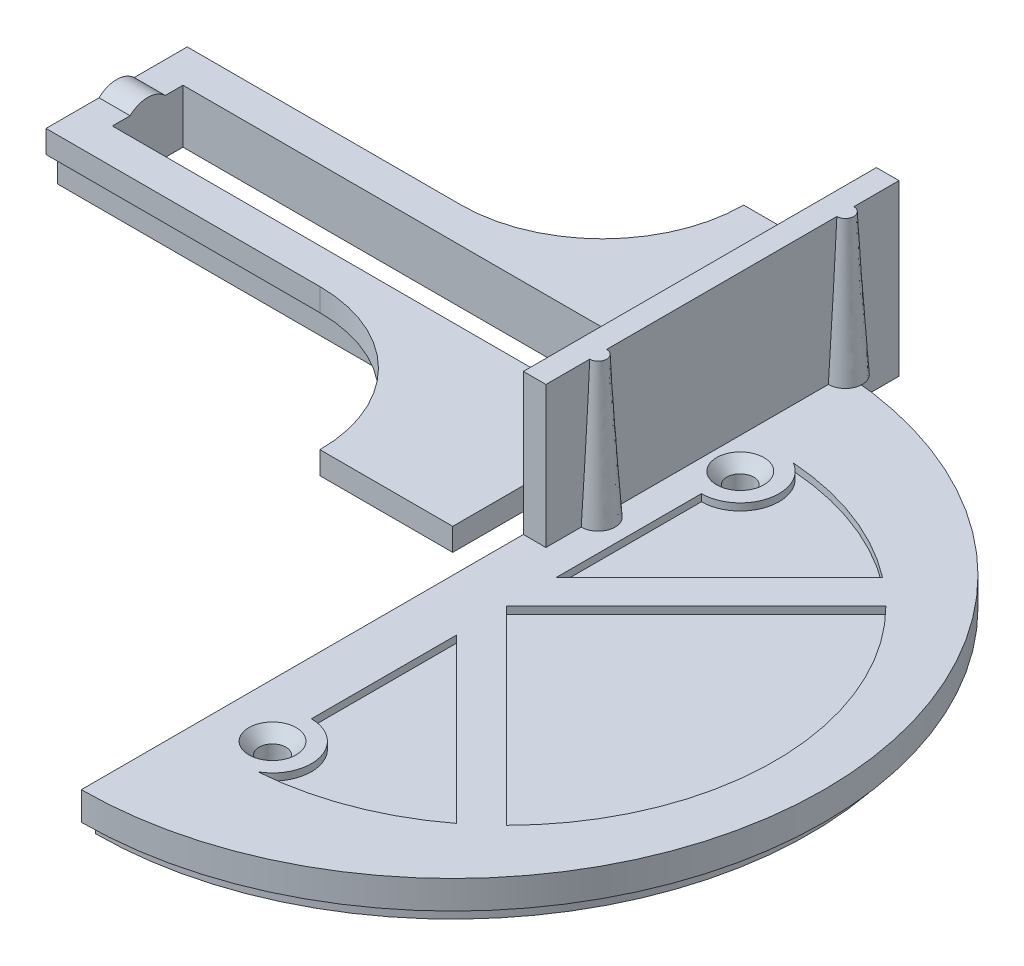
from build123d import *

# Parameters (mm, degrees)
BOSS_EXTRUDE1_DEPTH                           = 98.552
CUT_EXTRUDE2_DEPTH                            = 100.834602258
CUT_EXTRUDE2_DEPTH_BACK                       = 100.834602258
SKETCH2_W                                     = 92.964
SKETCH2_H                                     = 3.187725502
BOSS_EXTRUDE2_START                           = -4.064
BOSS_EXTRUDE2_DEPTH                           = 4.064
SKETCH10_W                                    = 4.064
SKETCH10_H                                    = 8.636
BOSS_EXTRUDE3_DEPTH                           = 63.5
REVOLVE1_ANGLE                                = 180
CUT_EXTRUDE3_DEPTH                            = 1.27
CSK_FOR_1_FLAT_HEAD_SOCKET_CAP_SCREW1_A_COUNT = 2
CSK_FOR_1_FLAT_HEAD_SOCKET_CAP_SCREW1_A_PITCH = 84.1248


with BuildPart() as part:
    # Sketch1 → Boss-Extrude1 (new body)
    with BuildSketch(Plane(origin=(0, 0, 0), x_dir=(0, 0, -1), z_dir=(1, 0, 0))):
        with BuildLine():
            Line((-10.668, -4.826), (10.668, -4.826))
            Line((10.668, -4.826), (10.668, 0.762))
            Line((10.668, 0.762), (12.7, 0.762))
            Line((12.7, 0.762), (12.7, 4.826))
            Line((12.7, 4.826), (3.162274498, 4.826))
            ThreePointArc((3.162274498, 4.826), (0, 6.096), (-3.162274498, 4.826))
            Line((-3.162274498, 4.826), (-12.7, 4.826))
            Line((-12.7, 4.826), (-12.7, 0.762))
            Line((-12.7, 0.762), (-10.668, 0.762))
            Line((-10.668, 0.762), (-10.668, -4.826))
        make_face()
    extrude(amount=BOSS_EXTRUDE1_DEPTH)

    # Sketch2 → Cut-Extrude2 (cut, two sides: drawn at the far end of the back side and taken through both)
    with BuildSketch(Plane(origin=(0, 4.826, 0), x_dir=(1, 0, 0), z_dir=(0, 1, 0)).offset(-CUT_EXTRUDE2_DEPTH_BACK)):
        with Locations((52.07, -4.756137249)):
            Rectangle(SKETCH2_W, SKETCH2_H)
        Polygon((5.588, 6.35), (5.588, 0), (5.588, -3.162274498), (98.552, -3.162274498), (98.552, 6.35), align=None)
    extrude(amount=CUT_EXTRUDE2_DEPTH + CUT_EXTRUDE2_DEPTH_BACK, mode=Mode.SUBTRACT)

    # Sketch3 → Boss-Extrude2 (add)
    with BuildSketch(Plane(origin=(0, 4.826, 0), x_dir=(1, 0, 0), z_dir=(0, 1, 0)).offset(BOSS_EXTRUDE2_START)):
        with BuildLine():
            Line((98.552, -12.7), (49.276, -12.7))
            ThreePointArc((49.276, -12.7), (67.236512242, -20.139487758), (74.676, -38.1))
            Line((74.676, -38.1), (98.552, -38.1))
            Line((98.552, -38.1), (98.552, -12.7))
        make_face()
    boss_extrude2 = extrude(amount=BOSS_EXTRUDE2_DEPTH)

    # Mirror1: Boss-Extrude2 across plane
    add(boss_extrude2.mirror(Plane.XY))

    # Sketch10 → Boss-Extrude3 (add)
    with BuildSketch(Plane(origin=(0, 0, -38.1), x_dir=(-1, 0, 0), z_dir=(0, 0, -1))):
        Polygon((-102.616, 0.762), (-98.552, 0.762), (-98.552, 4.826), (-98.552, 22.606), (-102.616, 22.606), align=None)
        with Locations((-100.584, -3.556)):
            Rectangle(SKETCH10_W, SKETCH10_H)
    extrude(amount=-BOSS_EXTRUDE3_DEPTH)

    # Loft1: read off the stored shape, not the designer's step
    # Loft1: loft between two sections, ruled curve by curve
    loft1_from = [
        Edge.make_bspline([(101.095067692, 22.606, -28.544648401), (101.288364493, 22.606, -31.586513017), (104.33022911, 22.606, -31.393216216), (104.136932308, 22.606, -28.351351599), (103.943635507, 22.606, -25.309486983), (100.90177089, 22.606, -25.502783784), (101.095067692, 22.606, -28.544648401)], [0.5, 0.5, 0.5, 0.5, 1, 1, 1, 1.5, 1.5, 1.5, 1.5], 3, [1, 0.333333333, 0.333333333, 1, 0.333333333, 0.333333333, 1]),
    ]
    loft1_to = [
        Edge.make_bspline([(99.932204152, -2.794, -29.8928335), (102.821871152, -2.794, -35.260425197), (108.189462849, -2.794, -32.370758196), (105.299795848, -2.794, -27.0031665), (102.410128848, -2.794, -21.635574803), (97.042537151, -2.794, -24.525241804), (99.932204152, -2.794, -29.8928335)], [0.5, 0.5, 0.5, 0.5, 1, 1, 1, 1.5, 1.5, 1.5, 1.5], 3, [1, 0.333333333, 0.333333333, 1, 0.333333333, 0.333333333, 1]),
    ]
    loft1 = Solid(Shell([*[Face.make_surface_from_curves(loft1_from[k], loft1_to[k]) for k in range(1)], Face(Wire(loft1_from)), Face(Wire(loft1_to))]))
    add(loft1)

    # Loft2: read off the stored shape, not the designer's step
    # Loft2: loft between two sections, ruled curve by curve
    loft2_from = [
        Edge.make_bspline([(101.103424589, 22.606, 15.815743121), (101.475938347, 22.606, 12.790592298), (104.50108917, 22.606, 13.163106056), (104.128575411, 22.606, 16.188256879), (103.756061653, 22.606, 19.213407702), (100.73091083, 22.606, 18.840893944), (101.103424589, 22.606, 15.815743121)], [0.5, 0.5, 0.5, 0.5, 1, 1, 1, 1.5, 1.5, 1.5, 1.5], 3, [1, 0.333333333, 0.333333333, 1, 0.333333333, 0.333333333, 1]),
    ]
    loft2_to = [
        Edge.make_bspline([(99.789147173, -2.794, 17.141827659), (97.509491854, -2.794, 11.488122004), (103.163197509, -2.794, 9.208466686), (105.442852827, -2.794, 14.862172341), (107.722508146, -2.794, 20.515877996), (102.068802491, -2.794, 22.795533314), (99.789147173, -2.794, 17.141827659)], [0.5, 0.5, 0.5, 0.5, 1, 1, 1, 1.5, 1.5, 1.5, 1.5], 3, [1, 0.333333333, 0.333333333, 1, 0.333333333, 0.333333333, 1]),
    ]
    loft2 = Solid(Shell([*[Face.make_surface_from_curves(loft2_from[k], loft2_to[k]) for k in range(1)], Face(Wire(loft2_from)), Face(Wire(loft2_to))]))
    add(loft2)


with BuildPart() as body_2:
    # Sketch17 → Revolve1 (revolve)
    with BuildSketch(Plane.ZY.offset(-98.552)):
        Polygon((-26.162, -10.922), (-23.114, -10.922), (-23.114, -7.874), (-14.986, -7.874), (-14.986, -9.398), (-8.636, -9.398), (-8.636, -7.874), (22.383656596, -7.874), (22.383656596, -9.144), (31.589471145, -9.144), (31.589471145, -6.096), (38.1, -6.096), (38.1, -2.794), (-28.702, -2.794), (-28.702, -7.874), (-26.162, -7.874), align=None)
    revolve(axis=Axis((98.552, -6.096, 38.1), (0, -1, 0)), revolution_arc=REVOLVE1_ANGLE)

    # Sketch19 → Cut-Extrude3 (cut)
    with BuildSketch(Plane(origin=(0, -2.794, 0), x_dir=(1, 0, 0), z_dir=(0, 1, 0))):
        with BuildLine():
            Line((108.204, -38.1), (142.32897326, -72.22497326))
            ThreePointArc((142.32897326, -72.22497326), (156.464, -38.1), (142.32897326, -3.97502674))
            Line((142.32897326, -3.97502674), (108.204, -38.1))
        make_face()
        with BuildLine():
            Line((108.204, -47.080256121), (137.542152268, -76.418408389))
            ThreePointArc((137.542152268, -76.418408389), (125.316721094, -83.224077572), (111.652792819, -86.236612138))
            ThreePointArc((111.652792819, -86.236612138), (114.957465658, -78.378884761), (108.204, -73.1774))
            Line((108.204, -73.1774), (108.204, -47.080256121))
        make_face()
        with BuildLine():
            Line((108.204, -29.119743879), (137.542152268, 0.218408389))
            ThreePointArc((137.542152268, 0.218408389), (125.316721094, 7.024077572), (111.652792819, 10.036612138))
            ThreePointArc((111.652792819, 10.036612138), (114.957465658, 2.178884761), (108.204, -3.0226))
            Line((108.204, -3.0226), (108.204, -29.119743879))
        make_face()
    extrude(amount=-CUT_EXTRUDE3_DEPTH, mode=Mode.SUBTRACT)

    # Sketch21 → CSK for #1 Flat Head Socket Cap Screw1 (revolve, cut)
    with BuildSketch(Plane(origin=(108.204, -2.794, 80.1624), x_dir=(0, 0, 1), z_dir=(1, 0, 0))):
        Polygon((0, 0), (0, 8.128), (2.413, 8.128), (2.413, 2.118403422), (4.2545, 0), align=None)
    csk_for_1_flat_head_socket_cap_screw1 = revolve(axis=Axis((108.204, 3.556, 80.1624), (0, -1, 0)), mode=Mode.SUBTRACT)

    # CSK for #1 Flat Head Socket Cap Screw1 a: CSK for #1 Flat Head Socket Cap Screw1 ×2
    with Locations(*[(0, 0, -i * CSK_FOR_1_FLAT_HEAD_SOCKET_CAP_SCREW1_A_PITCH) for i in range(1, CSK_FOR_1_FLAT_HEAD_SOCKET_CAP_SCREW1_A_COUNT)]):
        add(csk_for_1_flat_head_socket_cap_screw1, mode=Mode.SUBTRACT)


solid = Compound([part.part, body_2.part])
